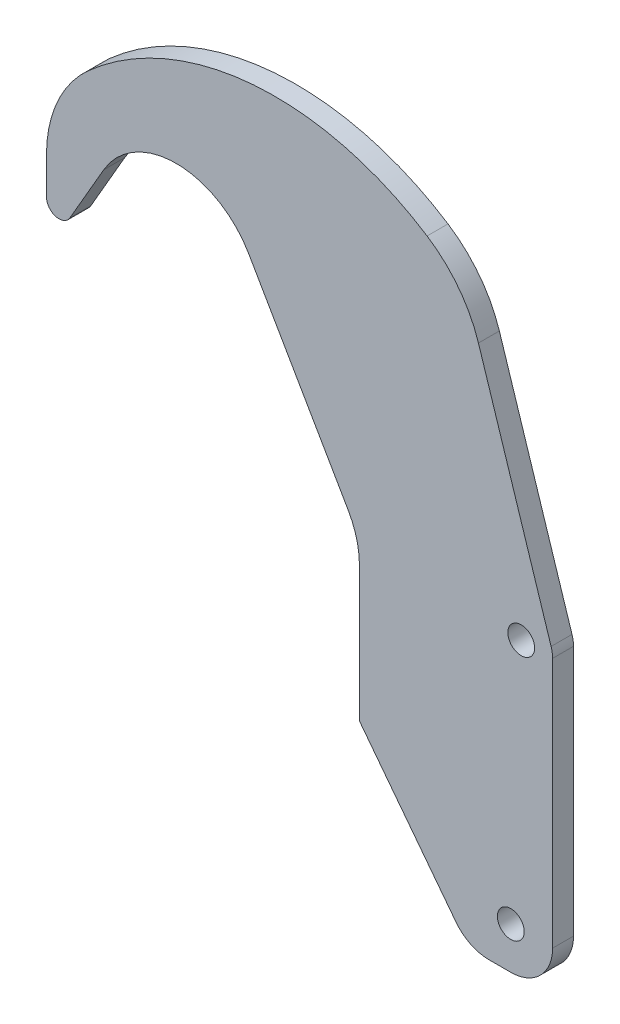
from build123d import *

# Parameters (mm, degrees)
SKETCH1_R           = 2.032
BOSS_EXTRUDE1_DEPTH = 1.5875
FILLET1_R           = 19.05


with BuildPart() as part:
    # Sketch1 → Boss-Extrude1 (new, symmetric)
    with BuildSketch(Plane.XY):
        with BuildLine():
            Line((10.998522628, 23.8125), (26.121491242, -2.38125))
            ThreePointArc((26.121491242, -2.38125), (27.390226607, -5.444248127), (27.822968614, -8.73125))
            Line((27.822968614, -8.73125), (27.822968614, -29.239270948))
            Line((27.822968614, -29.239270948), (42.458005799, -48.315226419))
            ThreePointArc((42.458005799, -48.315226419), (44.687348893, -50.145027996), (47.496113055, -50.8))
            Line((47.496113055, -50.8), (50.8, -50.8))
            ThreePointArc((50.8, -50.8), (55.290128061, -48.940128061), (57.15, -44.45))
            Line((57.15, -44.45), (57.15, -6.35))
            ThreePointArc((57.15, -6.35), (57.092731075, -5.613653081), (56.922301612, -4.895015263))
            Line((56.922301612, -4.895015263), (44.14775092, 34.919871855))
            ThreePointArc((44.14775092, 34.919871855), (10.787539912, 46.268643377), (-19.685944915, 28.575))
            Line((-19.685944915, 28.575), (-19.685944915, 15.875))
            ThreePointArc((-19.685944915, 15.875), (-18.273995196, 14.034911301), (-16.131166521, 14.9225))
            Line((-16.131166521, 14.9225), (-10.998522628, 23.8125))
            ThreePointArc((-10.998522628, 23.8125), (0, 30.1625), (10.998522628, 23.8125))
        make_face()
        with Locations((50.8, -44.45)):
            Circle(SKETCH1_R, mode=Mode.SUBTRACT)
        with Locations((52.3875, -6.35)):
            Circle(SKETCH1_R, mode=Mode.SUBTRACT)
    extrude(amount=BOSS_EXTRUDE1_DEPTH, both=True)

    # Fillet1
    fillet1_edges = [part.edges().sort_by_distance(p)[0] for p in [
        (-19.685944915, 28.575, 0),
        (44.14775092, 34.919871855, 0),
    ]]
    fillet(fillet1_edges, radius=FILLET1_R)


solid = part.part
